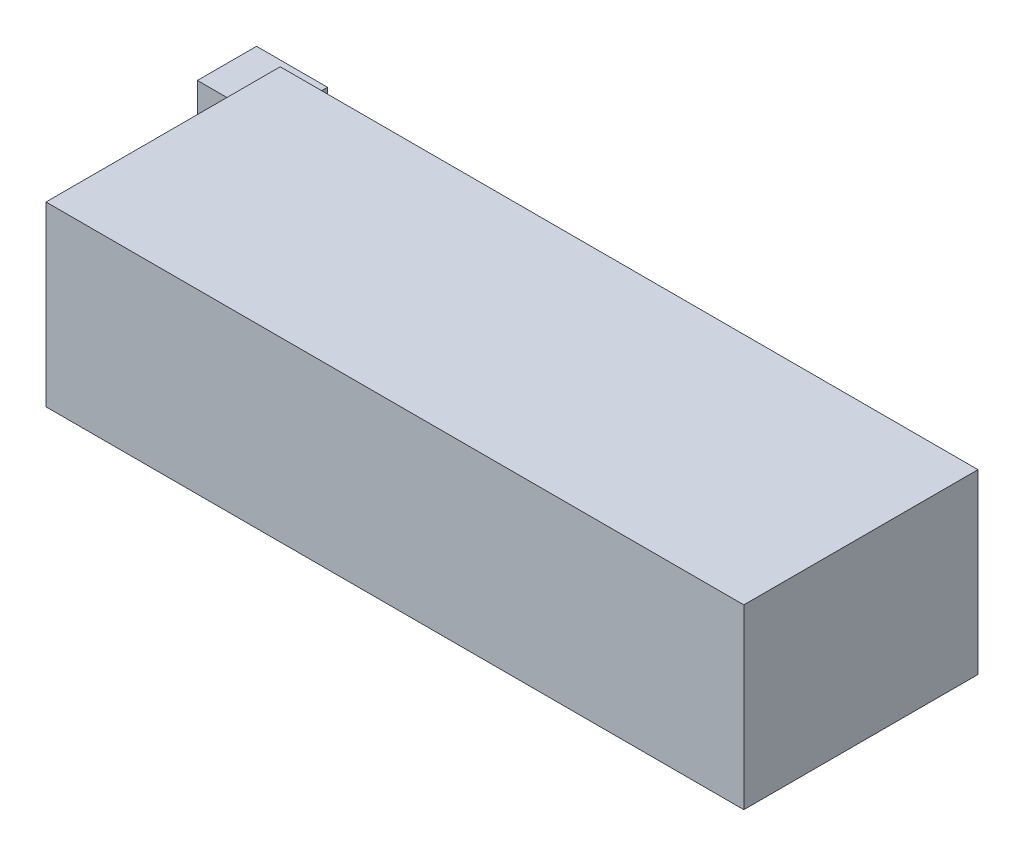
from build123d import *

# Parameters (mm, degrees)
SKETCH1_W           = 74.93
SKETCH1_H           = 25.146
BOSS_EXTRUDE1_DEPTH = 19.05
SKETCH2_W           = 6.35
SKETCH2_H           = 10.16
BOSS_EXTRUDE2_DEPTH = 7.62
FILLET1_R           = 2.54


with BuildPart() as part:
    # Sketch1 → Boss-Extrude1 (new body)
    with BuildSketch(Plane(origin=(0, 0, 0), x_dir=(1, 0, 0), z_dir=(0, 1, 0))):
        with Locations((37.465, -12.573)):
            Rectangle(SKETCH1_W, SKETCH1_H)
    extrude(amount=BOSS_EXTRUDE1_DEPTH)

    # Sketch2 → Boss-Extrude2 (add)
    with BuildSketch(Plane.ZY):
        with Locations((-1.905, 9.525)):
            Rectangle(SKETCH2_W, SKETCH2_H)
    extrude(amount=BOSS_EXTRUDE2_DEPTH)

    # Fillet1
    fillet1_edges = [part.edges().sort_by_distance(p)[0] for p in [
        (0, 9.525, 1.27),
        (0, 9.525, 0),
    ]]
    fillet(fillet1_edges, radius=FILLET1_R)


solid = part.part
